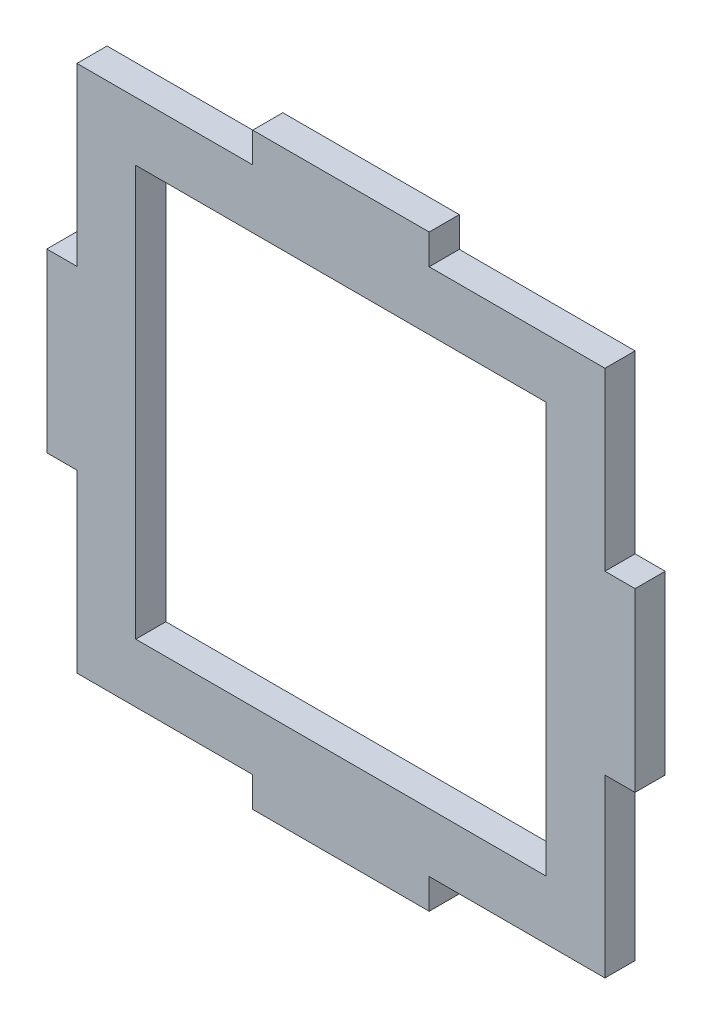
from build123d import *

# Parameters (mm, degrees)
BOSS_EXTRUDE2_DEPTH = 5.12
SKETCH4_W           = 69.76
SKETCH4_H           = 69.76
CUT_EXTRUDE1_DEPTH  = 135.278230551


with BuildPart() as part:
    # Sketch3 → Boss-Extrude2 (new body)
    with BuildSketch(Plane.XY):
        Polygon((59.88, 89.76), (89.76, 89.76), (89.76, 59.88), (94.88, 59.88), (94.88, 29.88), (89.76, 29.88), (89.76, 0), (59.88, 0), (59.88, -5.12), (29.88, -5.12), (29.88, 0), (0, 0), (0, 29.88), (-5.12, 29.88), (-5.12, 59.88), (0, 59.88), (0, 89.76), (29.88, 89.76), (29.88, 94.88), (59.88, 94.88), align=None)
    extrude(amount=BOSS_EXTRUDE2_DEPTH)

    # Sketch4 → Cut-Extrude1 (cut, through all)
    with BuildSketch(Plane.XY.offset(5.12)):
        with Locations((44.88, 44.88)):
            Rectangle(SKETCH4_W, SKETCH4_H)
    extrude(amount=-CUT_EXTRUDE1_DEPTH, mode=Mode.SUBTRACT)


solid = part.part
